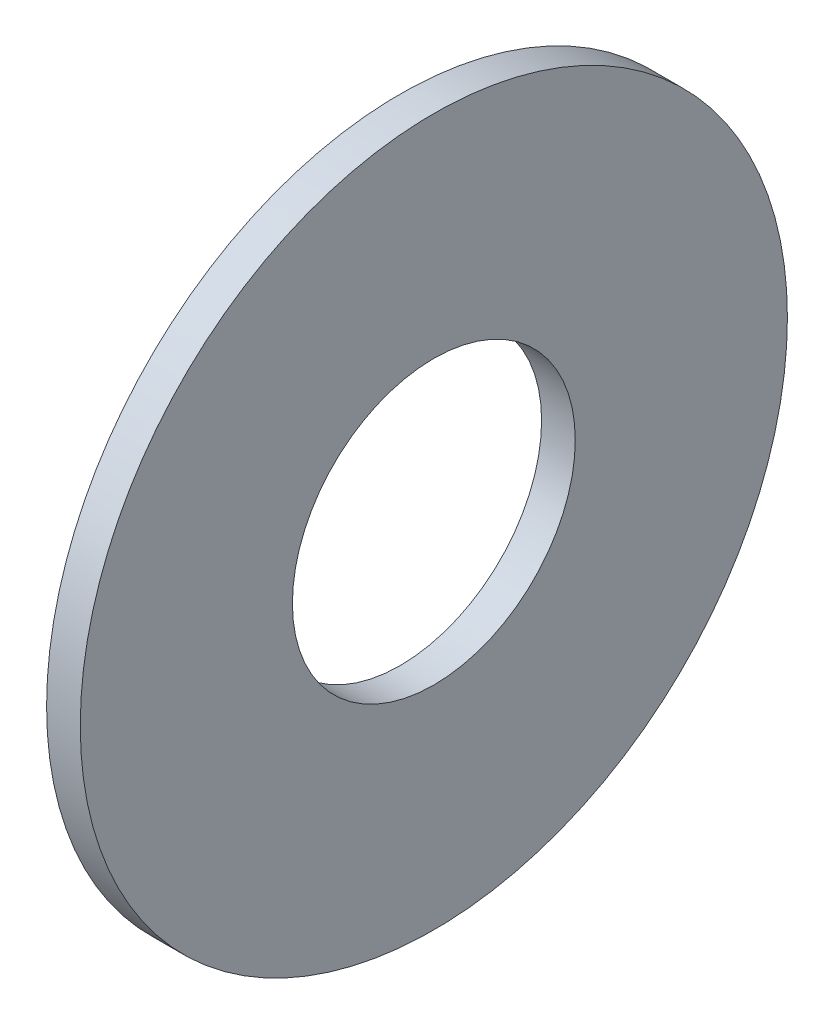
from build123d import *

# Parameters (mm, degrees)
SKETCH1_W = 1
SKETCH1_H = 6.3


with BuildPart() as part:
    # Sketch1 → Base-Revolve (revolve)
    with BuildSketch(Plane.XY):
        with Locations((-0.5, 7.35)):
            Rectangle(SKETCH1_W, SKETCH1_H)
    revolve(axis=Axis((-34.925, 0, 0), (1, 0, 0)))


solid = part.part
